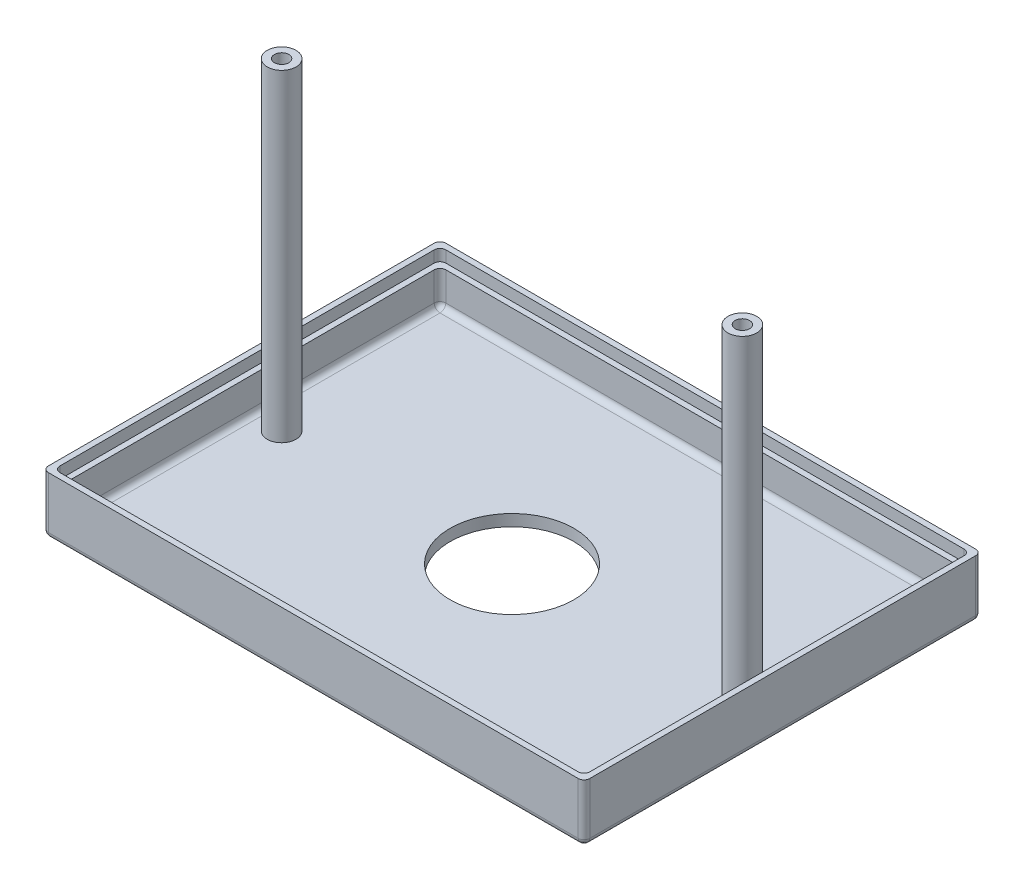
from build123d import *

# Parameters (mm, degrees)
SKETCH1_W           = 90
SKETCH1_H           = 65
BOSS_EXTRUDE1_DEPTH = 8
SHELL1_T            = 2
SKETCH3_W           = 92
SKETCH3_H           = 67
SKETCH3_W_2         = 90
SKETCH3_H_2         = 65
CUT_EXTRUDE1_DEPTH  = 2
FILLET2_R           = 1
FILLET3_R           = 1
FILLET4_R           = 1
SKETCH2_R           = 2.5
BOSS_EXTRUDE2_DEPTH = 56
SKETCH4_R           = 1.25
CUT_EXTRUDE2_DEPTH  = 10
FILLET5_R           = 1
SKETCH5_R           = 10.75
CUT_EXTRUDE3_DEPTH  = 10
SKETCH6_R           = 1.5
CUT_EXTRUDE4_DEPTH  = 10
FILLET6_R           = 1


with BuildPart() as part:
    # Sketch1 → Boss-Extrude1 (new body)
    with BuildSketch(Plane(origin=(0, 0, 0), x_dir=(1, 0, 0), z_dir=(0, 1, 0))):
        Rectangle(SKETCH1_W, SKETCH1_H)
    extrude(amount=BOSS_EXTRUDE1_DEPTH)

    # Shell1
    shell1_openings = [part.faces().sort_by_distance(p)[0] for p in [
        (0, 8, 0),
    ]]
    offset(amount=SHELL1_T, openings=shell1_openings, kind=Kind.INTERSECTION)

    # Sketch3 → Cut-Extrude1 (cut)
    with BuildSketch(Plane(origin=(0, 8, 0), x_dir=(1, 0, 0), z_dir=(0, 1, 0))):
        Rectangle(SKETCH3_W, SKETCH3_H)
        Rectangle(SKETCH3_W_2, SKETCH3_H_2, mode=Mode.SUBTRACT)
    extrude(amount=-CUT_EXTRUDE1_DEPTH, mode=Mode.SUBTRACT)

    # Fillet2
    fillet2_edges = [part.edges().sort_by_distance(p)[0] for p in [
        (46, 7, -33.5),
        (46, 7, 33.5),
        (-46, 7, 33.5),
        (-46, 7, -33.5),
    ]]
    fillet(fillet2_edges, radius=FILLET2_R)

    # Fillet3
    fillet3_edges = [part.edges().sort_by_distance(p)[0] for p in [
        (-45, 0, 0),
        (0, 0, 32.5),
        (45, 0, 0),
        (0, 0, -32.5),
    ]]
    fillet(fillet3_edges, radius=FILLET3_R)

    # Fillet4
    # the kernel refuses this fillet: 1 mm, written as the material it adds along each edge
    with BuildSketch(Plane(origin=(44, 1, 31.5), x_dir=(0, 0, 1), z_dir=(1, 0, 0))) as fillet4_piece_1_section:
        Polygon((0, 0), (FILLET4_R, 0), (FILLET4_R, FILLET4_R), (0, FILLET4_R), align=None)
    fillet4_piece_1 = extrude(amount=FILLET4_R, mode=Mode.PRIVATE)
    fillet4_piece_1 = fillet4_piece_1 - Plane(origin=(44, 1, 31.5), x_dir=(0, 0.7071067811865475, -0.7071067811865475), z_dir=(1, 0, 0)) * Sphere(FILLET4_R, mode=Mode.PRIVATE)
    add(fillet4_piece_1)
    with BuildSketch(Plane(origin=(-44, 1, 31.5), x_dir=(-1, 0, 0), z_dir=(0, 0, 1))) as fillet4_piece_2_section:
        Polygon((0, 0), (FILLET4_R, 0), (FILLET4_R, FILLET4_R), (0, FILLET4_R), align=None)
    fillet4_piece_2 = extrude(amount=FILLET4_R, mode=Mode.PRIVATE)
    fillet4_piece_2 = fillet4_piece_2 - Plane(origin=(-44, 1, 31.5), x_dir=(0.7071067811865475, 0.7071067811865475, 0), z_dir=(0, 0, 1)) * Sphere(FILLET4_R, mode=Mode.PRIVATE)
    add(fillet4_piece_2)
    with BuildSketch(Plane(origin=(44, 1, -31.5), x_dir=(0, 0, -1), z_dir=(1, 0, 0))) as fillet4_piece_3_section:
        Polygon((0, 0), (FILLET4_R, 0), (FILLET4_R, -FILLET4_R), (0, -FILLET4_R), align=None)
    fillet4_piece_3 = extrude(amount=FILLET4_R, mode=Mode.PRIVATE)
    fillet4_piece_3 = fillet4_piece_3 - Plane(origin=(44, 1, -31.5), x_dir=(0, 0.7071067811865475, 0.7071067811865475), z_dir=(1, 0, 0)) * Sphere(FILLET4_R, mode=Mode.PRIVATE)
    add(fillet4_piece_3)
    with BuildSketch(Plane(origin=(-44, 1, -31.5), x_dir=(-1, 0, 0), z_dir=(0, 0, -1))) as fillet4_piece_4_section:
        Polygon((0, 0), (FILLET4_R, 0), (FILLET4_R, -FILLET4_R), (0, -FILLET4_R), align=None)
    fillet4_piece_4 = extrude(amount=FILLET4_R, mode=Mode.PRIVATE)
    fillet4_piece_4 = fillet4_piece_4 - Plane(origin=(-44, 1, -31.5), x_dir=(0.7071067811865475, 0.7071067811865475, 0), z_dir=(0, 0, -1)) * Sphere(FILLET4_R, mode=Mode.PRIVATE)
    add(fillet4_piece_4)
    with BuildSketch(Plane(origin=(45, 1, -32.5), x_dir=(0, 0, 1), z_dir=(0, 1, 0)), Plane(origin=(-45, 1, -32.5), x_dir=(1, 0, 0), z_dir=(0, 1, 0))) as fillet4_piece_5:
        with BuildLine():
            CenterArc((FILLET4_R, -FILLET4_R), FILLET4_R, 90, 90)
            Line((0, -FILLET4_R), (0, 0))
            Line((0, 0), (FILLET4_R, 0))
        make_face()
    extrude(amount=5)
    with BuildSketch(Plane(origin=(45, 1, 32.5), x_dir=(0, 0, -1), z_dir=(0, 1, 0)), Plane(origin=(-45, 1, 32.5), x_dir=(1, 0, 0), z_dir=(0, 1, 0))) as fillet4_piece_6:
        with BuildLine():
            CenterArc((FILLET4_R, FILLET4_R), FILLET4_R, 180, 90)
            Line((0, FILLET4_R), (0, 0))
            Line((0, 0), (FILLET4_R, 0))
        make_face()
    extrude(amount=5)

    # Sketch2 → Boss-Extrude2 (add)
    with BuildSketch(Plane(origin=(0, 0, 0), x_dir=(1, 0, 0), z_dir=(0, 1, 0))):
        with Locations(Location((-40, 0, 0), (0, 0, 90))):
            Circle(SKETCH2_R)
        with Locations(Location((40, 0, 0), (0, 0, 90))):
            Circle(SKETCH2_R)
    extrude(amount=BOSS_EXTRUDE2_DEPTH)

    # Sketch4 → Cut-Extrude2 (cut)
    with BuildSketch(Plane(origin=(0, 56, 0), x_dir=(1, 0, 0), z_dir=(0, 1, 0))):
        with Locations(Location((40, 0, 0), (0, 0, 270))):
            Circle(SKETCH4_R)
        with Locations(Location((-40, 0, 0), (0, 0, 270))):
            Circle(SKETCH4_R)
    extrude(amount=-CUT_EXTRUDE2_DEPTH, mode=Mode.SUBTRACT)

    # Fillet5
    fillet5_edges = [part.edges().sort_by_distance(p)[0] for p in [
        (40, 46, -1.25),
        (-40, 46, -1.25),
    ]]
    fillet(fillet5_edges, radius=FILLET5_R)

    # Sketch5 → Cut-Extrude3 (cut)
    with BuildSketch(Plane(origin=(0, -2, 0), x_dir=(-1, 0, 0), z_dir=(0, -1, 0))):
        with Locations(Location((0, 0, 0), (0, 0, 90))):
            Circle(SKETCH5_R)
    extrude(amount=-CUT_EXTRUDE3_DEPTH, mode=Mode.SUBTRACT)

    # Sketch6 → Cut-Extrude4 (cut)
    with BuildSketch(Plane(origin=(0, -2, 0), x_dir=(-1, 0, 0), z_dir=(0, -1, 0))):
        with Locations(Location((-41.26748628, -28.672065144, 0), (0, 0, 90))):
            Circle(SKETCH6_R)
    extrude(amount=-CUT_EXTRUDE4_DEPTH, mode=Mode.SUBTRACT)

    # Fillet6
    fillet6_edges = [part.edges().sort_by_distance(p)[0] for p in [
        (0, -2, -34.5),
        (47, -2, 0),
        (0, -2, 34.5),
        (-47, -2, 0),
        (-47, 3, -34.5),
        (47, 3, -34.5),
        (47, 3, 34.5),
        (-47, 3, 34.5),
    ]]
    fillet(fillet6_edges, radius=FILLET6_R)


solid = part.part
